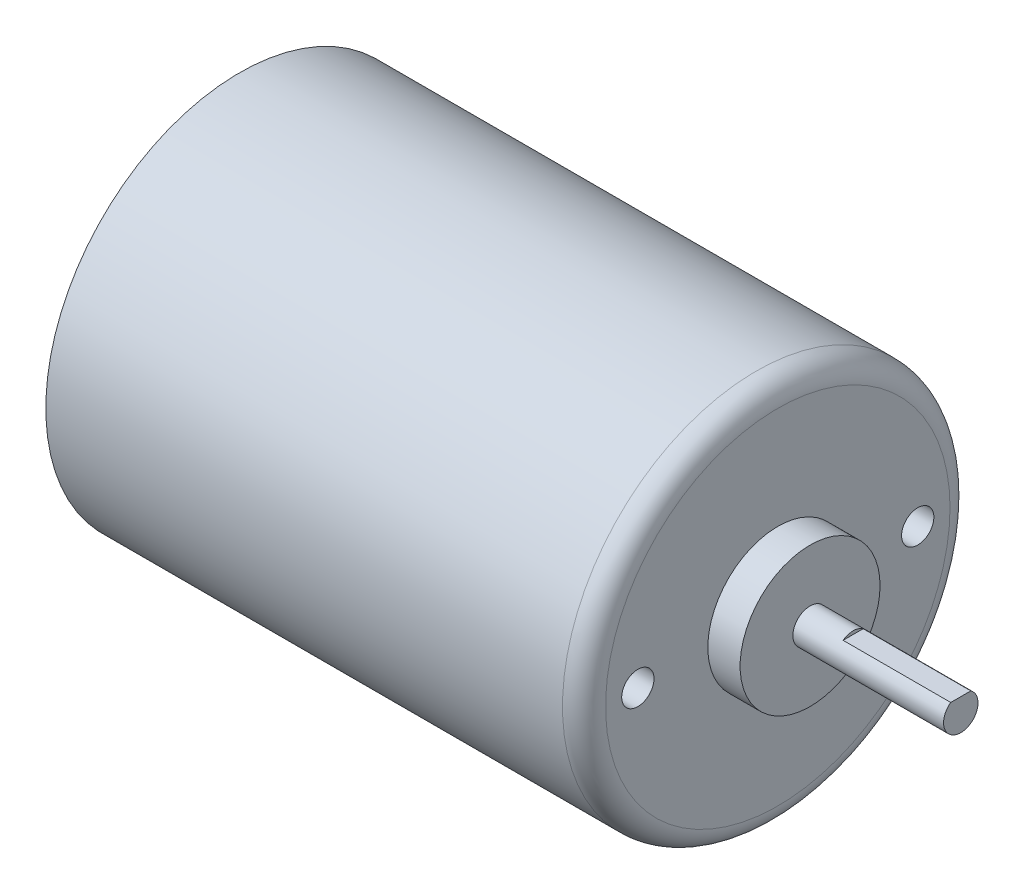
from build123d import *

# Parameters (mm, degrees)
SKETCH1_R           = 18
BOSS_EXTRUDE1_DEPTH = 25
SKETCH2_R           = 17.3
CUT_EXTRUDE1_DEPTH  = 0.5
SKETCH3_R           = 12
BOSS_EXTRUDE2_DEPTH = 0.5
SKETCH4_R           = 5.125
BOSS_EXTRUDE3_DEPTH = 2
FILLET1_R           = 2
SKETCH5_W           = 0.52
SKETCH5_H           = 4
BOSS_EXTRUDE4_DEPTH = 3
CHAMFER1_SIZE       = 1
SKETCH6_R           = 1.5
CUT_EXTRUDE2_DEPTH  = 6
SKETCH7_R           = 6.5
BOSS_EXTRUDE5_DEPTH = 3
SKETCH8_R           = 1.6
BOSS_EXTRUDE6_DEPTH = 14
CUT_EXTRUDE3_START  = -10
CUT_EXTRUDE3_DEPTH  = 10


with BuildPart() as part:
    # Sketch1 → Boss-Extrude1 (new, symmetric)
    with BuildSketch(Plane(origin=(0, 0, 0), x_dir=(0, 0, -1), z_dir=(1, 0, 0))):
        Circle(SKETCH1_R)
    extrude(amount=BOSS_EXTRUDE1_DEPTH, both=True)

    # Sketch2 → Cut-Extrude1 (cut)
    with BuildSketch(Plane.ZY.offset(25)):
        Circle(SKETCH2_R)
    extrude(amount=-CUT_EXTRUDE1_DEPTH, mode=Mode.SUBTRACT)

    # Sketch3 → Boss-Extrude2 (add, symmetric)
    with BuildSketch(Plane.ZY.offset(24.5)):
        Circle(SKETCH3_R)
    extrude(amount=BOSS_EXTRUDE2_DEPTH, both=True)

    # Sketch4 → Boss-Extrude3 (add, symmetric)
    with BuildSketch(Plane.ZY.offset(25)):
        Circle(SKETCH4_R)
    extrude(amount=BOSS_EXTRUDE3_DEPTH, both=True)

    # Fillet1
    fillet1_edges = [part.edges().sort_by_distance(p)[0] for p in [
        (25, 0, 18),
    ]]
    fillet(fillet1_edges, radius=FILLET1_R)

    # Sketch5 → Boss-Extrude4 (add, symmetric)
    with BuildSketch(Plane.ZY.offset(24.5)):
        with Locations((-13.26, 0)):
            Rectangle(SKETCH5_W, SKETCH5_H)
        with Locations((13.26, 0)):
            Rectangle(SKETCH5_W, SKETCH5_H)
    extrude(amount=BOSS_EXTRUDE4_DEPTH, both=True)

    # Chamfer1
    chamfer1_edges = [part.edges().sort_by_distance(p)[0] for p in [
        (-27.5, 2, 13.26),
        (-27.5, -2, 13.26),
        (-27.5, -2, -13.26),
        (-27.5, 2, -13.26),
    ]]
    chamfer(chamfer1_edges, length=CHAMFER1_SIZE)

    # Sketch6 → Cut-Extrude2 (cut)
    with BuildSketch(Plane(origin=(25, 0, 0), x_dir=(0, 0, -1), z_dir=(1, 0, 0))):
        with Locations((-13, 0)):
            Circle(SKETCH6_R)
        with Locations((13, 0)):
            Circle(SKETCH6_R)
    extrude(amount=-CUT_EXTRUDE2_DEPTH, mode=Mode.SUBTRACT)

    # Sketch7 → Boss-Extrude5 (add, symmetric)
    with BuildSketch(Plane(origin=(25, 0, 0), x_dir=(0, 0, -1), z_dir=(1, 0, 0))):
        Circle(SKETCH7_R)
    extrude(amount=BOSS_EXTRUDE5_DEPTH, both=True)

    # Sketch8 → Boss-Extrude6 (add)
    with BuildSketch(Plane(origin=(28, 0, 0), x_dir=(0, 0, -1), z_dir=(1, 0, 0))):
        Circle(SKETCH8_R)
    extrude(amount=BOSS_EXTRUDE6_DEPTH)

    # Sketch9 → Cut-Extrude3 (cut)
    with BuildSketch(Plane(origin=(42, 0, 0), x_dir=(0, 0, -1), z_dir=(1, 0, 0)).offset(CUT_EXTRUDE3_START)):
        with BuildLine():
            Line((-0.932737905, 1.3), (0.932737905, 1.3))
            ThreePointArc((0.932737905, 1.3), (0, 1.6), (-0.932737905, 1.3))
        make_face()
    extrude(amount=CUT_EXTRUDE3_DEPTH, mode=Mode.SUBTRACT)


solid = part.part
